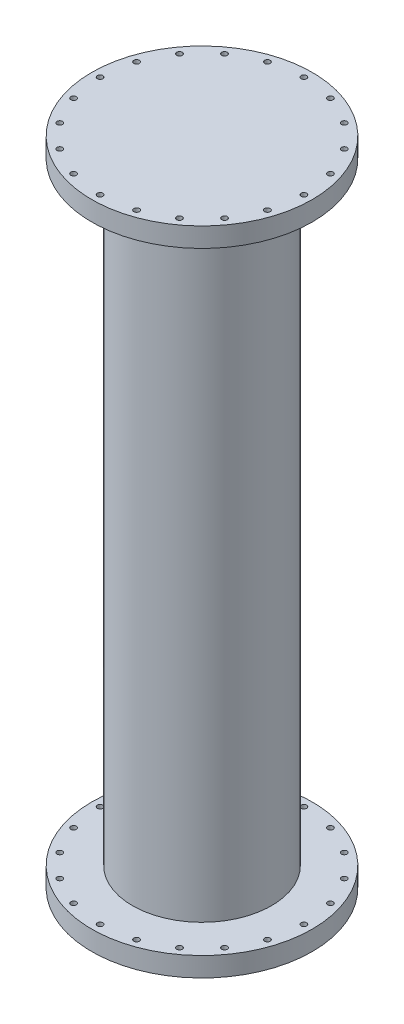
from build123d import *

# Parameters (mm, degrees)
ESQUISSE2_R                  = 10
ENL_V_MAT_EXTRU_1_DEPTH      = 2407.082292857
R_P_TITION_CIRCULAIRE1_COUNT = 20


with BuildPart() as part:
    # Esquisse1 → Révolution1 (revolve)
    with BuildSketch(Plane.XY):
        Polygon((0, 0), (396, 0), (396, -70), (250, -70), (250, -2270), (396, -2270), (396, -2340), (0, -2340), (0, -2270), (200, -2270), (200, -70), (0, -70), align=None)
    revolve(axis=Axis((0, 0, 0), (0, -1, 0)))

    # Esquisse2 → Enlèv. mat.-Extru.1 (cut, through all)
    with BuildSketch(Plane(origin=(0, 0, 0), x_dir=(1, 0, 0), z_dir=(0, 1, 0))):
        with Locations((366, 0)):
            Circle(ESQUISSE2_R)
    enl_v_mat_extru_1 = extrude(amount=-ENL_V_MAT_EXTRU_1_DEPTH, mode=Mode.SUBTRACT)

    # Répétition circulaire1: Enlèv. mat.-Extru.1 ×20 about axis
    r_p_tition_circulaire1_axis = Axis((0, 0, 0), (0, 1, 0))
    for i in range(1, R_P_TITION_CIRCULAIRE1_COUNT):
        add(enl_v_mat_extru_1.rotate(r_p_tition_circulaire1_axis, i * 360 / R_P_TITION_CIRCULAIRE1_COUNT), mode=Mode.SUBTRACT)


solid = part.part
